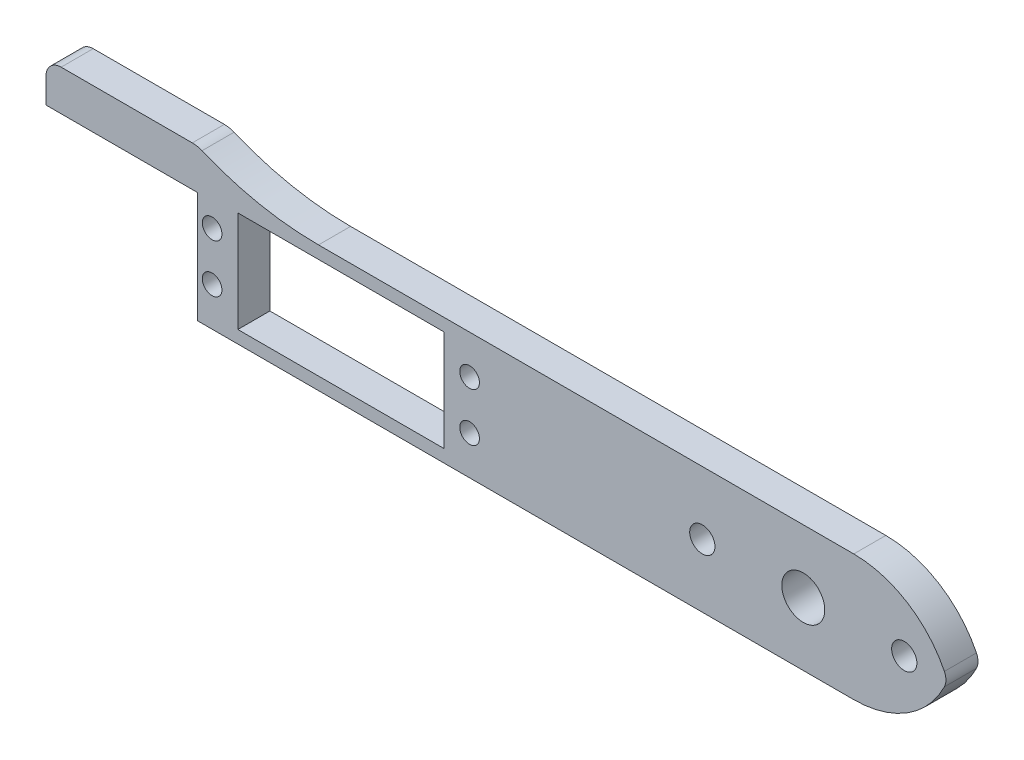
from build123d import *

# Parameters (mm, degrees)
SKETCH1_W           = 150
SKETCH1_H           = 25
SKETCH1_R           = 2.5
SKETCH1_R_2         = 4.25
BOSS_EXTRUDE1_DEPTH = 6.35
FILLET1_R           = 20
SKETCH2_R           = 1.95
SKETCH2_W           = 40.8
SKETCH2_H           = 20
CUT_EXTRUDE1_DEPTH  = 6.35
SKETCH3_W           = 6.35
SKETCH3_H           = 8
BOSS_EXTRUDE2_DEPTH = 30
FILLET2_R           = 60
FILLET4_R           = 5
FILLET5_R           = 3


with BuildPart() as part:
    # Sketch1 → Boss-Extrude1 (new body)
    with BuildSketch(Plane.XY):
        Rectangle(SKETCH1_W, SKETCH1_H)
        with Locations((65, 0)):
            Circle(SKETCH1_R, mode=Mode.SUBTRACT)
        with Locations((25, 0)):
            Circle(SKETCH1_R, mode=Mode.SUBTRACT)
        with Locations((45, 0)):
            Circle(SKETCH1_R_2, mode=Mode.SUBTRACT)
    extrude(amount=BOSS_EXTRUDE1_DEPTH)

    # Fillet1
    # the kernel refuses this fillet: 20 mm, written as the material it takes off along each edge
    with BuildSketch(Plane(origin=(75, 12.5, -50), x_dir=(-1, 0, 0), z_dir=(0, 0, 1))) as fillet1_piece_1:
        with BuildLine():
            CenterArc((FILLET1_R, FILLET1_R), FILLET1_R, 180, 90)
            Line((0, FILLET1_R), (0, 0))
            Line((0, 0), (FILLET1_R, 0))
        make_face()
    extrude(amount=106.35, mode=Mode.SUBTRACT)
    with BuildSketch(Plane(origin=(75, -12.5, -50), x_dir=(-1, 0, 0), z_dir=(0, 0, 1))) as fillet1_piece_2:
        with BuildLine():
            CenterArc((FILLET1_R, -FILLET1_R), FILLET1_R, 90, 90)
            Line((0, -FILLET1_R), (0, 0))
            Line((0, 0), (FILLET1_R, 0))
        make_face()
    extrude(amount=106.35, mode=Mode.SUBTRACT)

    # Sketch2 → Cut-Extrude1 (cut)
    with BuildSketch(Plane.XY.offset(6.35)):
        with Locations((-72.1, 4.8)):
            Circle(SKETCH2_R)
        with Locations((-72.1, -4.8)):
            Circle(SKETCH2_R)
        with Locations((-21.1, 4.8)):
            Circle(SKETCH2_R)
        with Locations((-21.1, -4.8)):
            Circle(SKETCH2_R)
        with Locations((-46.6, 0)):
            Rectangle(SKETCH2_W, SKETCH2_H)
    extrude(amount=-CUT_EXTRUDE1_DEPTH, mode=Mode.SUBTRACT)

    # Sketch3 → Boss-Extrude2 (add)
    with BuildSketch(Plane.ZY.offset(75)):
        with Locations((3.175, 13.5)):
            Rectangle(SKETCH3_W, SKETCH3_H)
    extrude(amount=BOSS_EXTRUDE2_DEPTH)

    # Fillet2
    # the kernel refuses this fillet: 60 mm, written as the material it adds along each edge
    with BuildSketch(Plane(origin=(-75, 12.5, 0), x_dir=(1, 0, 0), z_dir=(0, 0, 1))) as fillet2_piece_1:
        with BuildLine():
            CenterArc((23.979157617, 60), FILLET2_R, 246.443535691, 23.556464309)
            Line((0, 5), (-0.479583152, 3.9))
            ThreePointArc((-0.479583152, 3.9), (-1.2, 2.5), (-1.2, 0))
            Line((-1.2, 0), (0, -1.2))
            Line((0, -1.2), (23.979157617, -1.2))
            Line((23.979157617, -1.2), (23.979157617, 0))
        make_face()
    extrude(amount=6.35)

    # Fillet4
    fillet4_edges = [part.edges().sort_by_distance(p)[0] for p in [
        (-75, 17.5, 3.175),
    ]]
    fillet(fillet4_edges, radius=FILLET4_R)

    # Fillet5
    fillet5_edges = [part.edges().sort_by_distance(p)[0] for p in [
        (73.540496218, 0, 3.175),
        (-105, 17.5, 3.175),
    ]]
    fillet(fillet5_edges, radius=FILLET5_R)


solid = part.part
